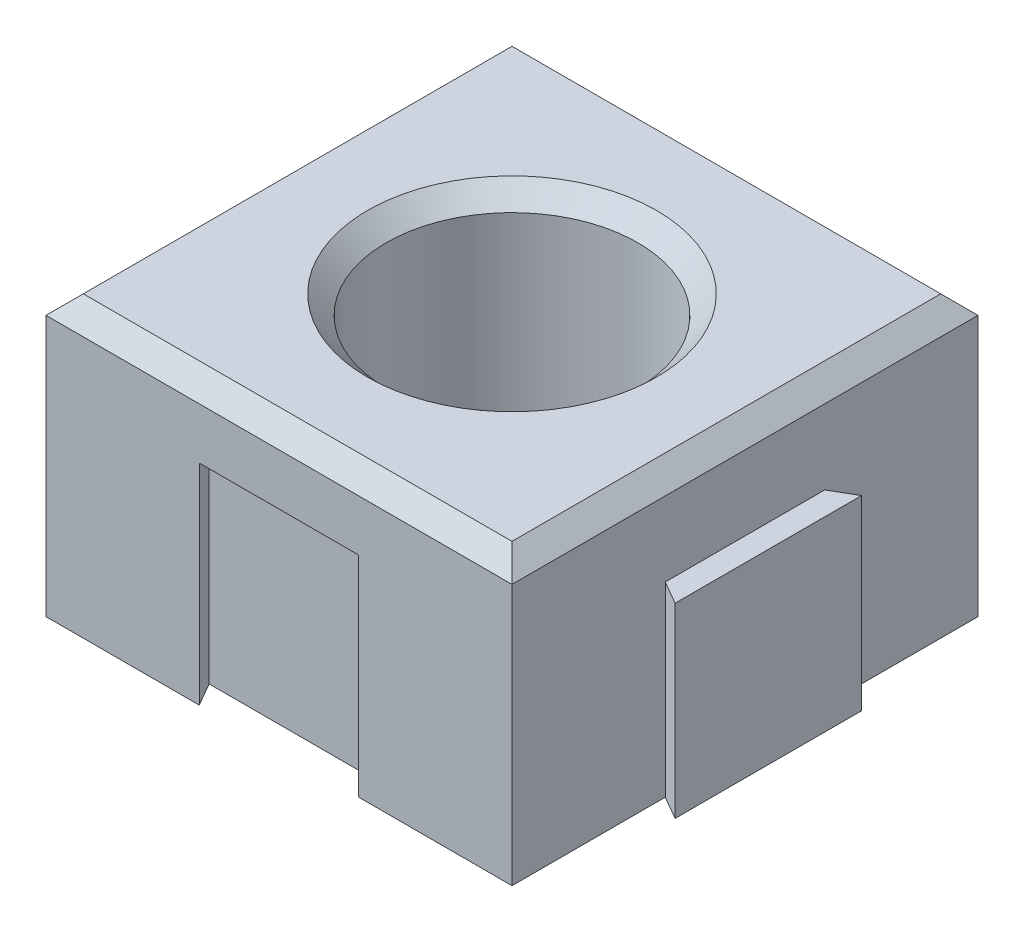
from build123d import *

# Parameters (mm, degrees)
SKETCH1_W           = 50
SKETCH1_H           = 50
BOSS_EXTRUDE1_DEPTH = 30
SKETCH2_R           = 13.5
CUT_EXTRUDE1_DEPTH  = 26
BOSS_EXTRUDE2_DEPTH = 20
BOSS_EXTRUDE3_DEPTH = 20
CUT_EXTRUDE2_DEPTH  = 20
CUT_EXTRUDE3_DEPTH  = 20
CHAMFER1_SIZE       = 2
SKETCH4_R           = 3.1
CUT_EXTRUDE4_DEPTH  = 2.5
CHAMFER2_SIZE       = 1
CHAMFER3_SIZE       = 2.5


with BuildPart() as part:
    # Sketch1 → Boss-Extrude1 (new body)
    with BuildSketch(Plane(origin=(0, 0, 0), x_dir=(1, 0, 0), z_dir=(0, 1, 0))):
        with Locations((25, 25)):
            Rectangle(SKETCH1_W, SKETCH1_H)
    extrude(amount=BOSS_EXTRUDE1_DEPTH)

    # Sketch2 → Cut-Extrude1 (cut)
    with BuildSketch(Plane(origin=(0, 30, 0), x_dir=(1, 0, 0), z_dir=(0, 1, 0))):
        with Locations(Location((25, 25, 0), (0, 0, 270))):
            Circle(SKETCH2_R)
    extrude(amount=-CUT_EXTRUDE1_DEPTH, mode=Mode.SUBTRACT)

    # Sketch3 → Boss-Extrude2 (add)
    with BuildSketch(Plane(origin=(0, 0, 0), x_dir=(1, 0, 0), z_dir=(0, 1, 0))):
        Polygon((50, 33.556624327), (52.5, 35), (52.5, 15), (50, 16.443375673), align=None)
    extrude(amount=BOSS_EXTRUDE2_DEPTH)

    # Sketch3<3> → Boss-Extrude3 (add)
    with BuildSketch(Plane(origin=(0, 0, 0), x_dir=(1, 0, 0), z_dir=(0, 1, 0))):
        Polygon((16.443375673, 50), (15, 52.5), (35, 52.5), (33.556624327, 50), align=None)
    extrude(amount=BOSS_EXTRUDE3_DEPTH)

    # Sketch3<4> → Cut-Extrude2 (cut)
    with BuildSketch(Plane(origin=(0, 0, 0), x_dir=(1, 0, 0), z_dir=(0, 1, 0))):
        Polygon((0, 33.556624327), (2.5, 35), (2.5, 15), (0, 16.443375673), align=None)
    extrude(amount=CUT_EXTRUDE2_DEPTH, mode=Mode.SUBTRACT)

    # Sketch3<5> → Cut-Extrude3 (cut)
    with BuildSketch(Plane(origin=(0, 0, 0), x_dir=(1, 0, 0), z_dir=(0, 1, 0))):
        Polygon((16.443375673, 0), (15, 2.5), (35, 2.5), (33.556624327, 0), align=None)
    extrude(amount=CUT_EXTRUDE3_DEPTH, mode=Mode.SUBTRACT)

    # Chamfer1
    chamfer1_edges = [part.edges().sort_by_distance(p)[0] for p in [
        (50, 30, -25),
        (25, 30, -38.5),
        (25, 30, -50),
        (0, 30, -25),
        (25, 30, 0),
    ]]
    chamfer(chamfer1_edges, length=CHAMFER1_SIZE)

    # Sketch4 → Cut-Extrude4 (cut)
    with BuildSketch(Plane(origin=(0, 0, 0), x_dir=(1, 0, 0), z_dir=(0, 1, 0))):
        with Locations(Location((12.5, 37.5, 0), (0, 0, 270))):
            Circle(SKETCH4_R)
        with Locations(Location((37.5, 37.5, 0), (0, 0, 270))):
            Circle(SKETCH4_R)
        with Locations(Location((37.5, 12.5, 0), (0, 0, 270))):
            Circle(SKETCH4_R)
        with Locations(Location((12.5, 12.5, 0), (0, 0, 270))):
            Circle(SKETCH4_R)
    extrude(amount=CUT_EXTRUDE4_DEPTH, mode=Mode.SUBTRACT)

    # Chamfer2
    chamfer2_edges = [part.edges().sort_by_distance(p)[0] for p in [
        (12.5, 2.5, -40.6),
        (12.5, 2.5, -15.6),
        (37.5, 2.5, -15.6),
        (37.5, 2.5, -40.6),
    ]]
    chamfer(chamfer2_edges, length=CHAMFER2_SIZE)

    # Chamfer3
    chamfer3_edges = [part.edges().sort_by_distance(p)[0] for p in [
        (0, 20, -25),
        (25, 20, 0),
    ]]
    chamfer(chamfer3_edges, length=CHAMFER3_SIZE - 0.0001)  # a hair under: the kernel refuses the full size


solid = part.part
